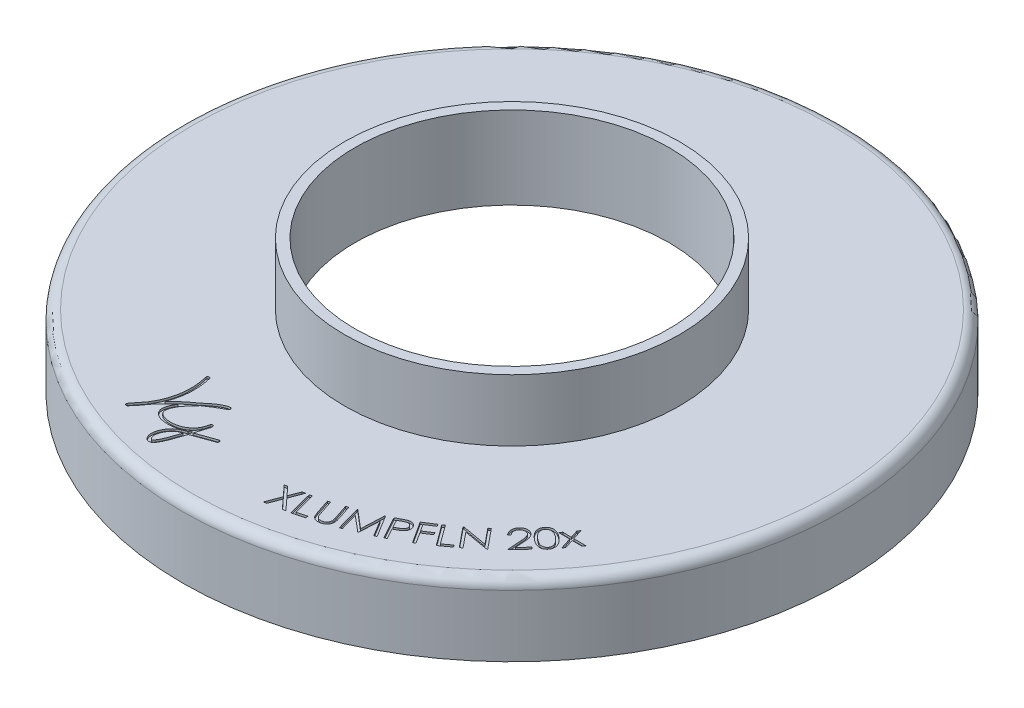
from build123d import *

# Parameters (mm, degrees)
SKETCH1_R                = 32
BOSS_EXTRUDE1_DEPTH      = 1
SKETCH2_R                = 15.25
CUT_EXTRUDE1_DEPTH       = 46.265881191
BOSS_EXTRUDE2_START      = 6
SKETCH3_R                = 32
SKETCH3_R_2              = 31.5
BOSS_EXTRUDE2_DEPTH      = 6
BOSS_EXTRUDE3_DEPTH      = 6
BOSS_EXTRUDE3_DEPTH_BACK = 2
SKETCH4_R                = 16.25
SKETCH4_R_2              = 15.25
FILLET1_R                = 1
TAG_DEPTH                = 0.2
COMPATIBILITY_TEXT_DEPTH = 0.2


with BuildPart() as part:
    # Sketch1 → Boss-Extrude1 (new body)
    with BuildSketch(Plane(origin=(0, 0, 0), x_dir=(1, 0, 0), z_dir=(0, 1, 0))):
        Circle(SKETCH1_R)
    extrude(amount=BOSS_EXTRUDE1_DEPTH)

    # Sketch2 → Cut-Extrude1 (cut, through all)
    with BuildSketch(Plane.XZ):
        Circle(SKETCH2_R)
    extrude(amount=-CUT_EXTRUDE1_DEPTH, mode=Mode.SUBTRACT)

    # Sketch3 → Boss-Extrude2 (add)
    with BuildSketch(Plane.XZ.offset(BOSS_EXTRUDE2_START)):
        Circle(SKETCH3_R)
        Circle(SKETCH3_R_2, mode=Mode.SUBTRACT)
    extrude(amount=-BOSS_EXTRUDE2_DEPTH)

    # Sketch4 → Boss-Extrude3 (add, two sides: drawn at the far end of the back side and taken through both)
    with BuildSketch(Plane(origin=(0, 1, 0), x_dir=(1, 0, 0), z_dir=(0, 1, 0)).offset(-BOSS_EXTRUDE3_DEPTH_BACK)):
        Circle(SKETCH4_R)
        Circle(SKETCH4_R_2, mode=Mode.SUBTRACT)
    extrude(amount=BOSS_EXTRUDE3_DEPTH + BOSS_EXTRUDE3_DEPTH_BACK)

    # Fillet1
    fillet1_edges = [part.edges().sort_by_distance(p)[0] for p in [
        (-32, 1, 0),
    ]]
    fillet(fillet1_edges, radius=FILLET1_R)

    # Sketch5 → Tag (cut)
    with BuildSketch(Plane(origin=(0, 1, 0), x_dir=(-1, 0, 0), z_dir=(0, 1, 0))):
        with BuildLine():
            ThreePointArc((10.547504807, 26.744009784), (10.762501606, 26.751175294), (10.769667116, 26.536178496))
            add(Edge.make_bspline(
                [(10.769667116, 26.536178496), (8.359942588, 23.963043087), (9.172058921, 20.559830458)],
                knots=[0, 0, 0, 1, 1, 1], degree=2))
            ThreePointArc((9.172058921, 20.559830458), (9.059283002, 20.376645961), (8.876098505, 20.48942188))
            add(Edge.make_bspline(
                [(10.547504807, 26.744009784), (8.031196572, 24.05143752), (8.876098505, 20.48942188)],
                knots=[0, 0, 0, 1, 1, 1], degree=2))
        make_face()
        with BuildLine():
            ThreePointArc((10.534270417, 26.727747601), (10.746239423, 26.764409685), (10.782901507, 26.552440679))
            add(Edge.make_bspline(
                [(10.782901507, 26.552440679), (8.696796986, 23.593964377), (5.496709323, 21.923279474)],
                knots=[0, 0, 0, 1, 1, 1], degree=2))
            ThreePointArc((5.496709323, 21.923279474), (5.291475436, 21.987731156), (5.355927118, 22.192965043))
            add(Edge.make_bspline(
                [(10.534270417, 26.727747601), (8.490657656, 23.829204131), (5.355927118, 22.192965043)],
                knots=[0, 0, 0, 1, 1, 1], degree=2))
        make_face()
        with BuildLine():
            ThreePointArc((5.918473616, 26.157590205), (5.722792881, 26.246943537), (5.812146213, 26.442624272))
            add(Edge.make_bspline(
                [(5.812146213, 26.442624272), (5.995414711, 26.510989656), (6.304529142, 26.742154319), (6.692476344, 27.319141867), (6.848542641, 27.923575729), (6.742443656, 28.288472399), (6.559286729, 28.429035448), (6.533379992, 28.432151338), (6.414940495, 28.368990764), (6.218827653, 28.077314295), (5.985024398, 27.561538715), (5.706192296, 26.796413886), (5.429323485, 25.922555064), (5.181407718, 25.084327905), (5.03985157, 24.587708128), (4.972706559, 24.348680798)],
                knots=[0, 0, 0, 0, 0.125, 0.25, 0.375, 0.5, 0.5625, 0.625, 0.6875, 0.75, 0.8125, 0.875, 0.9375, 0.96875, 1, 1, 1, 1], degree=3))
            ThreePointArc((4.972706559, 24.348680798), (4.785127723, 24.243375774), (4.679822699, 24.430954611))
            add(Edge.make_bspline(
                [(5.918473616, 26.157590205), (6.37174519, 26.326675922), (6.898390029, 26.954417097), (7.1709042, 27.893442168), (7.013518266, 28.441468489), (6.735696833, 28.709010273), (6.315363118, 28.761004784), (6.029261084, 28.390773259), (5.701440578, 27.673658549), (5.4175102, 26.892234197), (5.138340939, 26.011421915), (4.889185088, 25.168925801), (4.747200576, 24.670810912), (4.679822699, 24.430954611)],
                knots=[0, 0, 0, 0, 0.25, 0.375, 0.5, 0.5625, 0.625, 0.75, 0.8125, 0.875, 0.9375, 0.96875, 1, 1, 1, 1], degree=3))
        make_face()
        with BuildLine():
            ThreePointArc((3.278919729, 25.213091397), (3.084455876, 25.305063011), (3.176427489, 25.499526864))
            Line((3.176427489, 25.499526864), (5.814063795, 26.443324972))
            ThreePointArc((5.814063795, 26.443324972), (6.008527648, 26.351353358), (5.916556034, 26.156889505))
            Line((5.916556034, 26.156889505), (3.278919729, 25.213091397))
        make_face()
        with BuildLine():
            ThreePointArc((5.431809199, 21.906111295), (5.274307257, 22.052631281), (5.420827242, 22.210133222))
            add(Edge.make_bspline(
                [(5.420827242, 22.210133222), (5.471768801, 22.211973346), (5.558959348, 22.228448182), (5.833018113, 22.327738507), (6.241108244, 22.563266849), (6.790036287, 22.982709017), (7.513070963, 23.663310303), (8.271085244, 24.648483579), (8.438511524, 25.440659511), (8.147012134, 25.802826348), (7.477980546, 26.086872851), (5.893309591, 26.047325397), (5.056368276, 25.078538458), (4.977431814, 24.372907169)],
                knots=[0, 0, 0, 0, 0.03125, 0.0625, 0.125, 0.1875, 0.25, 0.375, 0.5, 0.5625, 0.625, 0.75, 1, 1, 1, 1], degree=3))
            ThreePointArc((4.977431814, 24.372907169), (4.809354094, 24.23865052), (4.675097445, 24.406728239))
            add(Edge.make_bspline(
                [(5.431809199, 21.906111295), (5.591205408, 21.911869045), (5.873496596, 22.00482733), (6.596165042, 22.413839944), (7.582648615, 23.25862214), (8.52509514, 24.47159273), (8.798575231, 25.470556207), (8.31117097, 26.081122872), (7.514422521, 26.390885548), (5.755297935, 26.360759465), (4.766423612, 25.223113968), (4.675097445, 24.406728239)],
                knots=[0, 0, 0, 0, 0.0625, 0.125, 0.25, 0.375, 0.5, 0.5625, 0.625, 0.75, 1, 1, 1, 1], degree=3))
        make_face()
    extrude(amount=-TAG_DEPTH, mode=Mode.SUBTRACT)

    # Sketch6 → Compatibility text (cut)
    # profile 1 of 11: a face of its own
    with BuildSketch(Plane(origin=(0, 1, 0), x_dir=(1, 0, 0), z_dir=(0, 1, 0))):
        Polygon((3.691104161, -25.806251778), (3.97606009, -25.751163637), (4.743287654, -26.591508189), (5.148936693, -25.525302259), (5.430887815, -25.471215721), (4.932590539, -26.793831907), (5.94871634, -27.902105144), (5.663760411, -27.957193285), (4.832931084, -27.055750977), (4.392726757, -28.20158431), (4.107770827, -28.256672451), (4.643628199, -26.849420849), align=None)
    # profile 2 of 11: a face of its own
    with BuildSketch(Plane(origin=(0, 1, 0), x_dir=(1, 0, 0), z_dir=(0, 1, 0))):
        Polygon((5.738761751, -25.43450648), (5.979647168, -25.371405518), (6.547555822, -27.534366255), (7.467026976, -27.292980038), (7.527623931, -27.52435023), (6.36726736, -27.828837409), align=None)
    # profile 3 of 11: a face of its own
    with BuildSketch(Plane(origin=(0, 1, 0), x_dir=(1, 0, 0), z_dir=(0, 1, 0))):
        with BuildLine():
            Line((7.150463527, -25.074830159), (7.384838527, -24.99720596))
            Line((7.384838527, -24.99720596), (7.853588527, -26.414974389))
            add(Edge.make_bspline(
                [(7.853588527, -26.414974389), (7.860196056, -26.435030188), (7.872717692, -26.473037048), (7.891612904, -26.526775188), (7.907879096, -26.574833374), (7.922886617, -26.616911622), (7.936347683, -26.652768489), (7.947983393, -26.682668375), (7.957694937, -26.706690858), (7.964374143, -26.72048939), (7.967270418, -26.726472787)],
                knots=[0, 0, 0, 0, 1.527554315, 2.894800762, 4.120716634, 5.197886157, 6.126511666, 6.891242949, 7.519214564, 8, 8, 8, 8], degree=3))
            add(Edge.make_bspline(
                [(7.967270418, -26.726472787), (7.97794347, -26.747638562), (7.998678296, -26.788757886), (8.037286882, -26.843677726), (8.078363112, -26.892236081), (8.124510776, -26.933111837), (8.176924578, -26.966079571), (8.235557728, -26.992979592), (8.301926306, -27.01210749), (8.373769906, -27.024741473), (8.448141165, -27.030335409), (8.52160727, -27.027603966), (8.592963276, -27.0183867), (8.638319555, -27.00471), (8.660880194, -26.997907082)],
                knots=[0, 0, 0, 0, 1.039961548, 2.020361388, 2.940587495, 3.829063858, 4.715965336, 5.651145082, 6.65340357, 7.740831346, 8.851013682, 9.922225713, 10.966495568, 12, 12, 12, 12], degree=3))
            add(Edge.make_bspline(
                [(8.660880194, -26.997907082), (8.679932369, -26.991002196), (8.717958821, -26.977220655), (8.771521016, -26.948707945), (8.822159353, -26.914962913), (8.868807835, -26.875465711), (8.91144404, -26.831899984), (8.94761629, -26.783662581), (8.978512858, -26.732687616), (9.002376801, -26.677958547), (9.021367427, -26.620571929), (9.033103618, -26.559837512), (9.038764772, -26.496206501), (9.037584636, -26.453043031), (9.036981957, -26.43100003)],
                knots=[0, 0, 0, 0, 0.992971686, 1.981883505, 2.96753539, 3.972988492, 4.974833976, 5.950915535, 6.924107644, 7.891876103, 8.873301214, 9.88341168, 10.91908699, 12, 12, 12, 12], degree=3))
            add(Edge.make_bspline(
                [(9.036981957, -26.43100003), (9.036278228, -26.421970294), (9.034706236, -26.401799635), (9.028874968, -26.368877792), (9.020032798, -26.330451598), (9.009764664, -26.286224979), (8.996070624, -26.236665021), (8.979310335, -26.181523275), (8.960409616, -26.12054803), (8.946560672, -26.078083951), (8.939325707, -26.05589987)],
                knots=[0, 0, 0, 0, 0.55945343, 1.249709089, 2.06317955, 2.99648923, 4.055086121, 5.239824241, 6.55802915, 8, 8, 8, 8], degree=3))
            Line((8.939325707, -26.05589987), (8.470575707, -24.638131441))
            Line((8.470575707, -24.638131441), (8.704950707, -24.560507242))
            Line((8.704950707, -24.560507242), (9.173700707, -25.978275671))
            add(Edge.make_bspline(
                [(9.173700707, -25.978275671), (9.182045492, -26.003932471), (9.198284526, -26.05386085), (9.219339611, -26.127895634), (9.237323775, -26.198718507), (9.252440011, -26.266506177), (9.264657458, -26.330932044), (9.273141809, -26.392454109), (9.278853403, -26.450752057), (9.280951682, -26.506446881), (9.279495132, -26.560326693), (9.274236856, -26.613676613), (9.263453132, -26.666512384), (9.248821005, -26.719267798), (9.229805557, -26.771455264), (9.206684867, -26.82367027), (9.178265183, -26.875026983), (9.146670391, -26.926351626), (9.111017688, -26.975837262), (9.070596422, -27.021602987), (9.026546182, -27.063671442), (8.978531312, -27.102167717), (8.926355644, -27.136470185), (8.870721695, -27.167636968), (8.811117768, -27.195022679), (8.769348912, -27.209741743), (8.748019617, -27.217258043)],
                knots=[0, 0, 0, 0, 1.302893448, 2.535443274, 3.716476496, 4.831407461, 5.889262101, 6.88233924, 7.829762613, 8.717177863, 9.572100832, 10.431270762, 11.302460789, 12.172904424, 13.073154295, 13.982598691, 14.927789799, 15.905431617, 16.892337253, 17.869180941, 18.849975647, 19.830803488, 20.837014731, 21.86204127, 22.908249902, 24, 24, 24, 24], degree=3))
            add(Edge.make_bspline(
                [(8.748019617, -27.217258043), (8.724580888, -27.224633722), (8.678608873, -27.239100154), (8.608840372, -27.254294026), (8.540688706, -27.265682621), (8.473354153, -27.271128434), (8.407399156, -27.271710402), (8.342428029, -27.267196641), (8.27862209, -27.257670209), (8.21635087, -27.243185898), (8.156169505, -27.224260946), (8.099077365, -27.20071269), (8.045176343, -27.173001296), (7.99450268, -27.141468507), (7.947021305, -27.105827458), (7.903490061, -27.065364183), (7.86256652, -27.021317887), (7.838292884, -26.989116015), (7.826044457, -26.972867018)],
                knots=[0, 0, 0, 0, 1.151211049, 2.257950605, 3.343689409, 4.387948137, 5.420858293, 6.432717911, 7.437533772, 8.441618149, 9.426555419, 10.39142667, 11.332818529, 12.264271816, 13.186044742, 14.110868149, 15.046747974, 16, 16, 16, 16], degree=3))
            add(Edge.make_bspline(
                [(7.826044457, -26.972867018), (7.818380799, -26.961442767), (7.801843494, -26.936790529), (7.778536972, -26.89481671), (7.754053738, -26.845899971), (7.729273933, -26.789337182), (7.702476663, -26.725951486), (7.6758816, -26.654512429), (7.647089237, -26.576251231), (7.628743666, -26.521197726), (7.619213527, -26.492598588)],
                knots=[0, 0, 0, 0, 0.629365606, 1.358099625, 2.195199275, 3.132281586, 4.183669872, 5.344353825, 6.620447667, 8, 8, 8, 8], degree=3))
            Line((7.619213527, -26.492598588), (7.150463527, -25.074830159))
        make_face()
    # profile 4 of 11: a face of its own
    with BuildSketch(Plane(origin=(0, 1, 0), x_dir=(1, 0, 0), z_dir=(0, 1, 0))):
        Polygon((9.970751718, -26.750660205), (9.302682808, -24.33078841), (9.339742102, -24.314762769), (11.080026558, -25.781609724), (11.183692423, -23.512479115), (11.220751718, -23.496453474), (12.539361494, -25.633372544), (12.314501718, -25.731028794), (11.382510532, -24.19807607), (11.285855885, -26.178745141), (11.228764538, -26.203284403), (9.697815019, -24.91672591), (10.190603481, -26.65500716), align=None)
    # profile 5 of 11: a face of its own
    with BuildSketch(Plane(origin=(0, 1, 0), x_dir=(1, 0, 0), z_dir=(0, 1, 0))):
        with BuildLine():
            Line((11.784534896, -23.242621906), (12.220232012, -23.005242098))
            add(Edge.make_bspline(
                [(12.220232012, -23.005242098), (12.25021263, -22.988921811), (12.307605311, -22.957679459), (12.391045869, -22.914852366), (12.466854881, -22.875981232), (12.535867787, -22.843023519), (12.597750162, -22.815119561), (12.652609784, -22.792786864), (12.700351473, -22.774596843), (12.730326438, -22.765859023), (12.744070153, -22.761852675)],
                knots=[0, 0, 0, 0, 1.415840007, 2.710379505, 3.890225294, 4.949447845, 5.882413069, 6.705363198, 7.406400654, 8, 8, 8, 8], degree=3))
            add(Edge.make_bspline(
                [(12.744070153, -22.761852675), (12.76170332, -22.757540421), (12.796384465, -22.749059024), (12.849044264, -22.741721941), (12.900922255, -22.738191497), (12.952532175, -22.738497332), (13.003579047, -22.74374905), (13.05426604, -22.752479517), (13.104182723, -22.76648423), (13.153640113, -22.783615925), (13.201510823, -22.805720742), (13.247483222, -22.831715287), (13.290541362, -22.862711135), (13.331922883, -22.897011561), (13.369996338, -22.936712756), (13.406236514, -22.980105005), (13.439201005, -23.028557493), (13.459092796, -23.062873532), (13.469230409, -23.080362291)],
                knots=[0, 0, 0, 0, 1.013876587, 1.994105663, 2.96649064, 3.918068694, 4.874163, 5.831212559, 6.788489419, 7.768052411, 8.7531965, 9.730936552, 10.714533513, 11.714277671, 12.730212196, 13.783700104, 14.870489271, 16, 16, 16, 16], degree=3))
            add(Edge.make_bspline(
                [(13.469230409, -23.080362291), (13.478724727, -23.098409499), (13.497215936, -23.133558384), (13.519214339, -23.187839653), (13.536933882, -23.241304407), (13.549669439, -23.294746901), (13.556929647, -23.347742204), (13.560447633, -23.400360453), (13.557496817, -23.452490187), (13.550810993, -23.504192009), (13.538476815, -23.554682367), (13.522491108, -23.604179264), (13.501961388, -23.652079169), (13.477122658, -23.698618872), (13.448089988, -23.743767468), (13.414155651, -23.787412436), (13.376418972, -23.830021499), (13.348257666, -23.85632245), (13.334014063, -23.869625111)],
                knots=[0, 0, 0, 0, 1.121579585, 2.184397154, 3.218601572, 4.21908567, 5.202554938, 6.159538394, 7.116036709, 8.070945569, 9.024616355, 9.971671592, 10.930637157, 11.888193644, 12.871791619, 13.880550049, 14.92801118, 16, 16, 16, 16], degree=3))
            add(Edge.make_bspline(
                [(13.334014063, -23.869625111), (13.321959927, -23.88013803), (13.295608315, -23.903120378), (13.24970288, -23.936674449), (13.195456678, -23.973701651), (13.132773179, -24.01418021), (13.061517873, -24.058318997), (12.981527394, -24.105708374), (12.892775618, -24.15642221), (12.830273536, -24.190422972), (12.79765589, -24.208166778)],
                knots=[0, 0, 0, 0, 0.603979289, 1.320362426, 2.145966369, 3.085269682, 4.138760384, 5.312201337, 6.597332087, 8, 8, 8, 8], degree=3))
            Line((12.79765589, -24.208166778), (12.64140589, -24.293302996))
            Line((12.64140589, -24.293302996), (13.195792909, -25.3104304))
            Line((13.195792909, -25.3104304), (12.976942749, -25.429621105))
            Line((12.976942749, -25.429621105), (11.784534896, -23.242621906))
        make_face()
        with BuildLine():
            Line((12.119070153, -23.335770945), (12.524719191, -24.079460848))
            Line((12.524719191, -24.079460848), (12.897315345, -23.882145143))
            add(Edge.make_bspline(
                [(12.897315345, -23.882145143), (12.91543305, -23.872283281), (12.950325498, -23.853290559), (12.999408928, -23.82331083), (13.044659574, -23.795097355), (13.085129356, -23.767005831), (13.121275664, -23.740021222), (13.153076219, -23.714019444), (13.180326113, -23.688534097), (13.209997995, -23.655412355), (13.240923475, -23.613055011), (13.268928182, -23.558537055), (13.286914623, -23.500536719), (13.296481022, -23.440486618), (13.296970249, -23.379367009), (13.288416162, -23.318949835), (13.27080691, -23.259739671), (13.252294916, -23.222846808), (13.24286823, -23.204060207)],
                knots=[0, 0, 0, 0, 1.140577861, 2.196611183, 3.180100296, 4.089195689, 4.920066052, 5.674204914, 6.359917705, 6.980929788, 8.131402936, 9.250291601, 10.353956582, 11.475584082, 12.601912854, 13.720801519, 14.839385455, 16, 16, 16, 16], degree=3))
            add(Edge.make_bspline(
                [(13.24286823, -23.204060207), (13.23235875, -23.186349398), (13.211623108, -23.151405233), (13.1718001, -23.105325843), (13.125811062, -23.06592526), (13.074343837, -23.033763884), (13.019670133, -23.008378701), (12.962426456, -22.992812119), (12.904156775, -22.986172078), (12.854635865, -22.988354338), (12.813233709, -22.9950232), (12.778629193, -23.003760001), (12.740907734, -23.015818715), (12.699968583, -23.031031222), (12.65589463, -23.049654147), (12.608574126, -23.071764352), (12.557829898, -23.096697866), (12.52348687, -23.115295474), (12.505688742, -23.124933605)],
                knots=[0, 0, 0, 0, 1.166458229, 2.301470585, 3.436482941, 4.58987488, 5.734133524, 6.843775924, 7.939756662, 9.048752323, 9.643477367, 10.316443894, 11.071193716, 11.889180514, 12.793201389, 13.78465606, 14.851907458, 16, 16, 16, 16], degree=3))
            Line((12.505688742, -23.124933605), (12.119070153, -23.335770945))
        make_face(mode=Mode.SUBTRACT)
    # profile 6 of 11: a face of its own
    with BuildSketch(Plane(origin=(0, 1, 0), x_dir=(1, 0, 0), z_dir=(0, 1, 0))):
        Polygon((13.420199108, -22.336245212), (14.469878596, -21.65966268), (14.602590935, -21.865992808), (13.76074398, -22.408360597), (14.182919461, -23.063408674), (15.024766416, -22.521040885), (15.158480358, -22.727871815), (14.316633403, -23.270239603), (14.978191897, -24.296882232), (14.770359365, -24.431096975), align=None)
    # profile 7 of 11: a face of its own
    with BuildSketch(Plane(origin=(0, 1, 0), x_dir=(1, 0, 0), z_dir=(0, 1, 0))):
        Polygon((14.700160358, -21.523300211), (14.901482474, -21.375563833), (16.230609076, -23.184958865), (16.999839846, -22.619554218), (17.14206741, -22.812863512), (16.171514525, -23.526004538), align=None)
    # profile 8 of 11: a face of its own
    with BuildSketch(Plane(origin=(0, 1, 0), x_dir=(1, 0, 0), z_dir=(0, 1, 0))):
        Polygon((17.466589247, -22.583150946), (15.889566009, -20.649557196), (15.931633317, -20.615502709), (18.424121298, -21.046692613), (17.217190208, -19.566824825), (17.407494695, -19.411576427), (18.984517933, -21.345170177), (18.941449022, -21.380226267), (16.474001106, -20.958551587), (17.666408958, -22.42039053), align=None)
    # profile 9 of 11: a face of its own
    with BuildSketch(Plane(origin=(0, 1, 0), x_dir=(1, 0, 0), z_dir=(0, 1, 0))):
        with BuildLine():
            Line((18.930193082, -19.012106921), (18.765930261, -19.186385767))
            add(Edge.make_bspline(
                [(18.765930261, -19.186385767), (18.745015126, -19.164523735), (18.703868382, -19.121514144), (18.649788997, -19.05233248), (18.603792478, -18.980670671), (18.565722616, -18.90684185), (18.534565727, -18.830964547), (18.512780301, -18.752211134), (18.498060335, -18.671430557), (18.491674831, -18.589046232), (18.49318127, -18.506880656), (18.502220483, -18.426405325), (18.518444486, -18.348168373), (18.543997017, -18.273098074), (18.576063458, -18.199989298), (18.616950994, -18.130103391), (18.665125863, -18.062412433), (18.702416349, -18.020683793), (18.721358947, -17.999486728)],
                knots=[0, 0, 0, 0, 1.09727902, 2.158697845, 3.180258103, 4.182603483, 5.169028676, 6.150793772, 7.141672039, 8.144182114, 9.143760224, 10.119001393, 11.078885863, 12.036589252, 12.991069334, 13.970758241, 14.9691979, 16, 16, 16, 16], degree=3))
            add(Edge.make_bspline(
                [(18.721358947, -17.999486728), (18.741012531, -17.97938314), (18.779506651, -17.94000763), (18.84251032, -17.888972441), (18.90748223, -17.845384788), (18.974833958, -17.809768807), (19.044329646, -17.781287371), (19.116272914, -17.7612392), (19.190524996, -17.749218526), (19.266016654, -17.744996446), (19.341319661, -17.747250944), (19.41449501, -17.757052484), (19.485272882, -17.772247553), (19.552843713, -17.795167891), (19.618079887, -17.823521394), (19.679834747, -17.859665985), (19.739404839, -17.901661706), (19.776016264, -17.934342016), (19.794576094, -17.950909004)],
                knots=[0, 0, 0, 0, 1.123959682, 2.201422226, 3.236835127, 4.24960094, 5.244214122, 6.235885751, 7.230611034, 8.24750809, 9.256501539, 10.239772083, 11.197397262, 12.147752458, 13.089622171, 14.038098265, 15.005431662, 16, 16, 16, 16], degree=3))
            add(Edge.make_bspline(
                [(19.794576094, -17.950909004), (19.81912217, -17.975860586), (19.867745027, -18.025286706), (19.928659095, -18.109679595), (19.978746779, -18.200752373), (20.010316859, -18.283348469), (20.031577167, -18.354956137), (20.045861747, -18.416396373), (20.059232694, -18.484902445), (20.071813716, -18.56052597), (20.082608522, -18.643408779), (20.09255801, -18.733408429), (20.101577755, -18.830579738), (20.106522483, -18.897748131), (20.1090793, -18.932479517)],
                knots=[0, 0, 0, 0, 1.189801313, 2.356854959, 3.528945189, 4.717973089, 5.357923934, 6.070359118, 6.86367302, 7.733232115, 8.678947509, 9.707880172, 10.81479227, 12, 12, 12, 12], degree=3))
            Line((20.1090793, -18.932479517), (20.171178658, -19.844939453))
            Line((20.171178658, -19.844939453), (20.962444684, -19.005596504))
            Line((20.962444684, -19.005596504), (21.138225934, -19.171361728))
            Line((21.138225934, -19.171361728), (19.973862953, -20.40633769))
            Line((19.973862953, -20.40633769), (19.878209908, -19.0040941))
            add(Edge.make_bspline(
                [(19.878209908, -19.0040941), (19.875940782, -18.970035148), (19.87158984, -18.904728706), (19.864241087, -18.810704644), (19.855589034, -18.724753216), (19.846937494, -18.646712418), (19.836758604, -18.576955416), (19.826497603, -18.515085569), (19.815115959, -18.461279433), (19.799368341, -18.400726601), (19.775158975, -18.332850844), (19.736201842, -18.258986099), (19.6889268, -18.191050668), (19.650597354, -18.15189646), (19.631314876, -18.132199068)],
                knots=[0, 0, 0, 0, 1.322369923, 2.535582229, 3.653325107, 4.66886977, 5.577039366, 6.383989687, 7.098087624, 7.706707056, 8.807312766, 9.880483176, 10.933730073, 12, 12, 12, 12], degree=3))
            add(Edge.make_bspline(
                [(19.631314876, -18.132199068), (19.618316266, -18.12078651), (19.592713912, -18.098308079), (19.551369249, -18.068828083), (19.507607253, -18.045047157), (19.462206574, -18.025006166), (19.414428704, -18.010615014), (19.364583331, -18.001014038), (19.312731591, -17.99676655), (19.259603751, -17.996605416), (19.206482098, -18.001692765), (19.154459095, -18.011124093), (19.104374929, -18.025539549), (19.056307784, -18.045417331), (19.010310439, -18.069860977), (18.96634137, -18.099385777), (18.924003973, -18.13332194), (18.898224964, -18.159471577), (18.885120966, -18.172763972)],
                knots=[0, 0, 0, 0, 0.99864427, 1.966952204, 2.924886058, 3.870515665, 4.828109869, 5.7999628, 6.796743926, 7.828304491, 8.864360286, 9.874111229, 10.87790761, 11.867952387, 12.872859265, 13.880905908, 14.922821111, 16, 16, 16, 16], degree=3))
            add(Edge.make_bspline(
                [(18.885120966, -18.172763972), (18.872003129, -18.187400879), (18.846355054, -18.21601905), (18.812942238, -18.262019978), (18.78531283, -18.309707288), (18.763047241, -18.359245685), (18.746223197, -18.410305757), (18.733629174, -18.462845593), (18.728157201, -18.517168085), (18.726756119, -18.572676155), (18.732106332, -18.628858754), (18.742374279, -18.684976751), (18.759246749, -18.740633306), (18.782073802, -18.795776404), (18.810070991, -18.851057523), (18.844422576, -18.905725526), (18.884533717, -18.959902238), (18.914751182, -18.994451409), (18.930193082, -19.012106921)],
                knots=[0, 0, 0, 0, 1.007967743, 1.970784722, 2.91097395, 3.831051962, 4.751926923, 5.666085915, 6.596786356, 7.547643364, 8.510726972, 9.486711031, 10.470331781, 11.488257238, 12.545457421, 13.645804036, 14.796945533, 16, 16, 16, 16], degree=3))
        make_face()
    # profile 10 of 11: a face of its own
    with BuildSketch(Plane(origin=(0, 1, 0), x_dir=(1, 0, 0), z_dir=(0, 1, 0))):
        with BuildLine():
            add(Edge.make_bspline(
                [(20.365736572, -18.200502178), (20.335641888, -18.174361686), (20.277103788, -18.123515007), (20.195357976, -18.045556418), (20.119816954, -17.970926325), (20.052708747, -17.897389081), (19.992233933, -17.826725782), (19.94030355, -17.757266706), (19.894505304, -17.690745334), (19.856947226, -17.625133586), (19.825068412, -17.56105199), (19.798395615, -17.497848971), (19.776801362, -17.435271775), (19.760156692, -17.373168756), (19.748043444, -17.311787307), (19.740920658, -17.251000082), (19.73900792, -17.190875691), (19.741463485, -17.131443464), (19.74840424, -17.072990631), (19.759873271, -17.01617813), (19.776132191, -16.96134809), (19.796188705, -16.908107301), (19.820214103, -16.856497891), (19.848336166, -16.80665498), (19.881030731, -16.758738231), (19.90591898, -16.728788218), (19.918521027, -16.713623171)],
                knots=[0, 0, 0, 0, 1.642822772, 3.195505425, 4.655127746, 6.018692442, 7.297915378, 8.486907948, 9.5918805, 10.624562576, 11.600025259, 12.540572882, 13.450130897, 14.326390695, 15.188680416, 16.026802507, 16.846071293, 17.665600087, 18.476387842, 19.269852164, 20.051503804, 20.83106299, 21.612956871, 22.395577026, 23.187608023, 24, 24, 24, 24], degree=3))
            add(Edge.make_bspline(
                [(19.918521027, -16.713623171), (19.931806616, -16.698706077), (19.958139289, -16.66913968), (20.001505235, -16.629084313), (20.047159849, -16.592844753), (20.095305123, -16.56079466), (20.145775826, -16.532678816), (20.198274288, -16.507803025), (20.253658506, -16.488175834), (20.310713745, -16.471336748), (20.369997725, -16.459251673), (20.431172977, -16.452428476), (20.493925217, -16.450008945), (20.558252159, -16.451732021), (20.624115512, -16.459742587), (20.691672874, -16.471726936), (20.760957152, -16.488273632), (20.831871244, -16.509995423), (20.904776365, -16.537042576), (20.979710833, -16.570869865), (21.056728351, -16.611745694), (21.136255371, -16.658647738), (21.217535873, -16.712699865), (21.301134269, -16.772945982), (21.387482612, -16.839371456), (21.444329188, -16.887656279), (21.473509008, -16.91244128)],
                knots=[0, 0, 0, 0, 0.817178336, 1.619686586, 2.412509315, 3.200814836, 3.983891862, 4.775565594, 5.575276828, 6.386147026, 7.208876232, 8.047898686, 8.902630924, 9.777604298, 10.678496341, 11.615331946, 12.584785841, 13.59195583, 14.649123947, 15.765337266, 16.954193484, 18.216190509, 19.542678326, 20.947711638, 22.433235032, 24, 24, 24, 24], degree=3))
            add(Edge.make_bspline(
                [(21.473509008, -16.91244128), (21.502064237, -16.937452838), (21.557802065, -16.986273664), (21.636429945, -17.060999755), (21.708351354, -17.134242398), (21.773621234, -17.206200302), (21.831501887, -17.277286559), (21.883487116, -17.346795023), (21.928167979, -17.41537986), (21.965902211, -17.483012187), (21.998134406, -17.549411648), (22.025379861, -17.614868156), (22.046857072, -17.679925432), (22.064079484, -17.743909658), (22.076219065, -17.807341843), (22.083260428, -17.869960425), (22.085357173, -17.931928631), (22.082243077, -17.99286696), (22.074824534, -18.052658174), (22.062675304, -18.110694575), (22.046821276, -18.16707609), (22.026064925, -18.221221428), (22.001476135, -18.273728474), (21.97230184, -18.324172315), (21.93922458, -18.373249731), (21.913974182, -18.403858989), (21.901193302, -18.419352338)],
                knots=[0, 0, 0, 0, 1.554297557, 3.033881095, 4.440530159, 5.757006654, 7.010388925, 8.192989406, 9.309747168, 10.35944863, 11.362229006, 12.330805896, 13.260313931, 14.165628454, 15.042415335, 15.902223685, 16.743462556, 17.578429158, 18.398317518, 19.208055444, 20.004292912, 20.793959899, 21.579830673, 22.375980109, 23.177977214, 24, 24, 24, 24], degree=3))
            add(Edge.make_bspline(
                [(21.901193302, -18.419352338), (21.888056244, -18.43392059), (21.861940198, -18.462881803), (21.819251829, -18.502225953), (21.774804558, -18.538069688), (21.727441141, -18.569263296), (21.678327823, -18.597395167), (21.626421322, -18.62090271), (21.572454727, -18.640442186), (21.516647496, -18.656571616), (21.4586856, -18.668077701), (21.399251415, -18.675127215), (21.338096332, -18.677157362), (21.275712626, -18.673757649), (21.21173795, -18.667004541), (21.146335574, -18.6547279), (21.079503158, -18.637606068), (21.010630811, -18.615960864), (20.939715089, -18.58834308), (20.866331413, -18.553264946), (20.789994702, -18.511725344), (20.710404858, -18.463316477), (20.628241122, -18.407707606), (20.54273076, -18.345431632), (20.454847095, -18.275715372), (20.395986699, -18.226034613), (20.365736572, -18.200502178)],
                knots=[0, 0, 0, 0, 0.809334345, 1.608930474, 2.393420427, 3.163587147, 3.947320206, 4.727440385, 5.51217239, 6.314791129, 7.122892582, 7.94851833, 8.782725506, 9.645030939, 10.525426761, 11.436330313, 12.388916865, 13.371750985, 14.414610975, 15.527316364, 16.72670066, 18.00060673, 19.370865716, 20.820757427, 22.366091636, 24, 24, 24, 24], degree=3))
        make_face()
        with BuildLine():
            add(Edge.make_bspline(
                [(20.522487373, -18.025221729), (20.548431369, -18.047206391), (20.598840168, -18.089922261), (20.673600557, -18.15000092), (20.745541928, -18.203543625), (20.813274016, -18.251912116), (20.878268443, -18.293602925), (20.939631302, -18.329747067), (20.997836479, -18.360166351), (21.053324489, -18.384326074), (21.106675249, -18.403786446), (21.158648628, -18.418564824), (21.209389898, -18.430409369), (21.259118314, -18.438000194), (21.308015418, -18.441405203), (21.355901243, -18.441610574), (21.402839012, -18.437611942), (21.46268231, -18.42687655), (21.533389854, -18.406414397), (21.610873481, -18.370746375), (21.679705282, -18.324463942), (21.717210834, -18.285201305), (21.735928879, -18.265606344)],
                knots=[0, 0, 0, 0, 1.475433559, 2.866745428, 4.160324659, 5.366041264, 6.477062271, 7.509344239, 8.455254422, 9.324520763, 10.133294647, 10.917267436, 11.667526356, 12.392755348, 13.097141748, 13.792458255, 14.468533702, 15.137746053, 16.428137898, 17.649803771, 18.827078207, 20, 20, 20, 20], degree=3))
            add(Edge.make_bspline(
                [(21.735928879, -18.265606344), (21.752771732, -18.244108592), (21.786413123, -18.201169651), (21.822479077, -18.12654256), (21.846052688, -18.045436063), (21.855189517, -17.973597806), (21.857023309, -17.913976526), (21.852966198, -17.867960525), (21.846368247, -17.821285832), (21.834388949, -17.77422923), (21.819340467, -17.72635021), (21.80049957, -17.677800837), (21.776510773, -17.629131692), (21.75860544, -17.596959637), (21.749450514, -17.580510191)],
                knots=[0, 0, 0, 0, 1.337156782, 2.670795385, 4.036975334, 5.466744451, 6.212439874, 6.960157678, 7.730642592, 8.523452578, 9.339622299, 10.193095959, 11.076137038, 12, 12, 12, 12], degree=3))
            add(Edge.make_bspline(
                [(21.749450514, -17.580510191), (21.737351191, -17.559983166), (21.712691844, -17.518147518), (21.670328021, -17.45750174), (21.624043296, -17.396385881), (21.572927814, -17.335664675), (21.517788939, -17.274389253), (21.458062352, -17.213156542), (21.393499545, -17.152279666), (21.348260634, -17.112462572), (21.325271828, -17.092228941)],
                knots=[0, 0, 0, 0, 0.879754638, 1.79300739, 2.730193115, 3.710653204, 4.723458217, 5.774229919, 6.868942794, 8, 8, 8, 8], degree=3))
            add(Edge.make_bspline(
                [(21.325271828, -17.092228941), (21.301842716, -17.072400802), (21.256183692, -17.033759412), (21.187454511, -16.979297659), (21.119782047, -16.9305135), (21.054080172, -16.885505616), (20.989728513, -16.845598548), (20.926786066, -16.810236494), (20.865498996, -16.779668778), (20.805502988, -16.754115636), (20.74760992, -16.732398621), (20.691207474, -16.71528845), (20.636686679, -16.702266245), (20.583872324, -16.69290642), (20.532595897, -16.688492266), (20.483033862, -16.687888139), (20.435258595, -16.691293982), (20.375196042, -16.701338723), (20.304893526, -16.72160974), (20.227652699, -16.756771048), (20.159238126, -16.802880082), (20.121879504, -16.841947618), (20.1033167, -16.86135955)],
                knots=[0, 0, 0, 0, 1.331895319, 2.595618656, 3.804067923, 4.951324891, 6.050913633, 7.088731648, 8.083301521, 9.021171298, 9.917353448, 10.765244215, 11.576994724, 12.348712351, 13.090473085, 13.80766762, 14.497715157, 15.165816449, 16.447434834, 17.659677756, 18.837137394, 20, 20, 20, 20], degree=3))
            add(Edge.make_bspline(
                [(20.1033167, -16.86135955), (20.086437342, -16.883010248), (20.05285141, -16.926090022), (20.017267752, -17.001413131), (19.993171713, -17.082946164), (19.983608992, -17.15571514), (19.983073892, -17.215970936), (19.986007804, -17.26254254), (19.993089391, -17.30960591), (20.004212918, -17.357301372), (20.019177298, -17.405386302), (20.038661564, -17.453665007), (20.061047495, -17.502810656), (20.087803422, -17.552757396), (20.119918749, -17.604233888), (20.158544433, -17.657338775), (20.203183348, -17.713124158), (20.254774808, -17.770693278), (20.312257862, -17.831286268), (20.376359452, -17.89411431), (20.446670609, -17.959595205), (20.496636778, -18.002845613), (20.522487373, -18.025221729)],
                knots=[0, 0, 0, 0, 1.187832734, 2.363506371, 3.587070215, 4.865261049, 5.531534139, 6.199183217, 6.887408711, 7.593573753, 8.321928914, 9.06961172, 9.850537889, 10.66373595, 11.525768602, 12.480406536, 13.510710811, 14.623880731, 15.83274101, 17.133422538, 18.516941843, 20, 20, 20, 20], degree=3))
        make_face(mode=Mode.SUBTRACT)
    # profile 11 of 11: a face of its own
    with BuildSketch(Plane(origin=(0, 1, 0), x_dir=(1, 0, 0), z_dir=(0, 1, 0))):
        Polygon((21.022723931, -16.485083278), (21.192495566, -16.256217092), (22.031337713, -16.270239528), (21.772924251, -15.471962285), (21.942195085, -15.243096099), (22.271221527, -16.27074033), (23.470640598, -16.275748342), (23.299366559, -16.507118535), (22.341834508, -16.500107317), (22.633300854, -17.407058439), (22.465031623, -17.634422221), (22.102952296, -16.498104112), align=None)
    extrude(amount=-COMPATIBILITY_TEXT_DEPTH, mode=Mode.SUBTRACT)


solid = part.part
